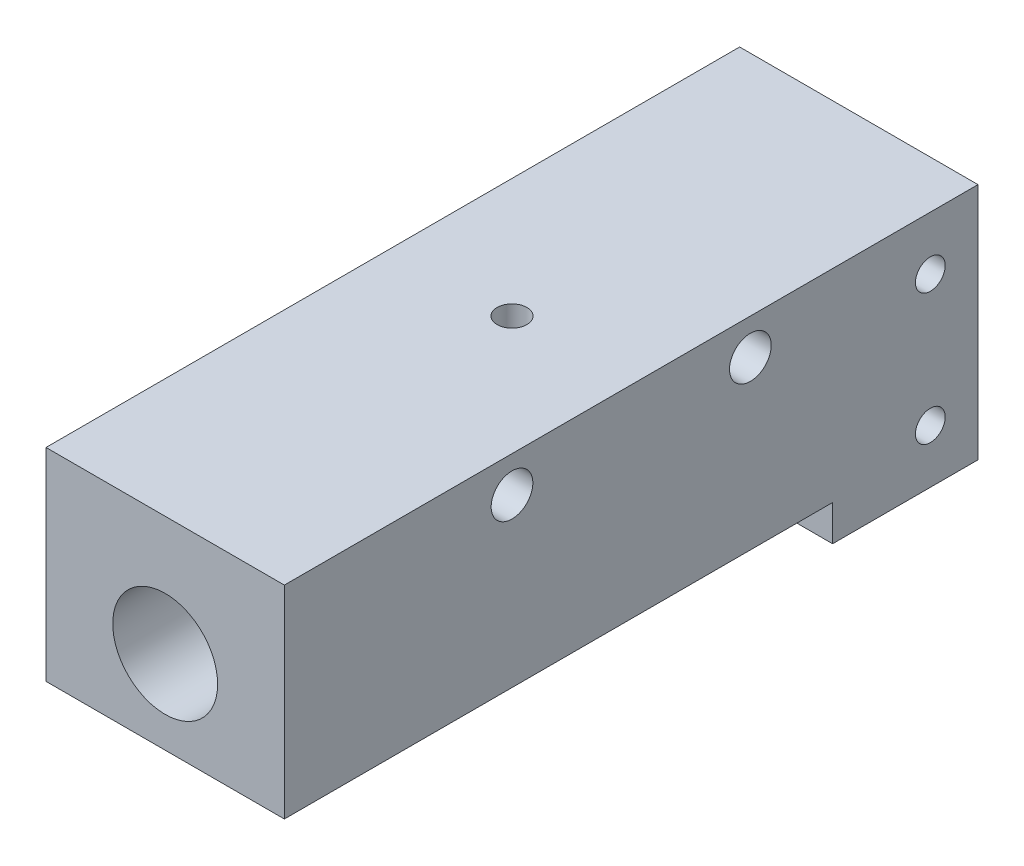
from build123d import *

# Parameters (mm, degrees)
SCHIZZO1_W                    = 20
SCHIZZO1_H                    = 20
ESTRUSIONE_ESTRUSIONE1_DEPTH  = 58.2
SCHIZZO2_R                    = 3
TAGLIO_ESTRUSIONE1_DEPTH      = 60.893572276
SCHIZZO4_R                    = 1.75
TAGLIO_ESTRUSIONE3_DEPTH      = 63.347734522
FORO_FILETTATO_G1_8_1_D       = 8.8
FORO_FILETTATO_G1_8_1_DEPTH   = 10
FORO_FILETTATO_G1_8_1_TIP     = 2.643786724
TAGLIO_ESTRUSIONE5_DEPTH      = 63.347734522
TAGLIO_ESTRUSIONE5_DEPTH_BACK = 63.347734522
FORO_FILETTATO_M3_1_D         = 2.5
FORO_FILETTATO_M3_1_DEPTH     = 5
FORO_FILETTATO_M3_1_TIP       = 0.751075774
FORO_FILETTATO_M3_2_D         = 2.5


with BuildPart() as part:
    # Schizzo1 → Estrusione-Estrusione1 (new body)
    with BuildSketch(Plane.XY):
        Rectangle(SCHIZZO1_W, SCHIZZO1_H)
    extrude(amount=-ESTRUSIONE_ESTRUSIONE1_DEPTH)

    # Schizzo2 → Taglio-Estrusione1 (cut, through all)
    with BuildSketch(Plane(origin=(0, 0, -58.2), x_dir=(-1, 0, 0), z_dir=(0, 0, -1))):
        Circle(SCHIZZO2_R)
    extrude(amount=-TAGLIO_ESTRUSIONE1_DEPTH, mode=Mode.SUBTRACT)

    # Schizzo4 → Taglio-Estrusione3 (cut, through all)
    with BuildSketch(Plane(origin=(10, 0, 0), x_dir=(0, 0, -1), z_dir=(1, 0, 0))):
        with Locations((19.1, 7)):
            Circle(SCHIZZO4_R)
        with Locations((39.1, 7)):
            Circle(SCHIZZO4_R)
    extrude(amount=-TAGLIO_ESTRUSIONE3_DEPTH, mode=Mode.SUBTRACT)

    # Foro filettato G1/8-1
    with Locations(Plane.XY):
        with Locations((0, 0)):
            Hole(FORO_FILETTATO_G1_8_1_D / 2, depth=FORO_FILETTATO_G1_8_1_DEPTH)
            with Locations((0, 0, -(FORO_FILETTATO_G1_8_1_DEPTH + FORO_FILETTATO_G1_8_1_TIP / 2))):  # 118° drill point
                Cone(0, FORO_FILETTATO_G1_8_1_D / 2, FORO_FILETTATO_G1_8_1_TIP, mode=Mode.SUBTRACT)

    # Schizzo10 → Taglio-Estrusione5 (cut, two sides: drawn at the far end of the back side and taken through both)
    with BuildSketch(Plane(origin=(10, 0, 0), x_dir=(0, 0, -1), z_dir=(1, 0, 0)).offset(-TAGLIO_ESTRUSIONE5_DEPTH_BACK)):
        Polygon((-131.2640095, -7), (0, -7), (46, -7), (46, -10), (46, -141.2640095), (-112.509379382, -350.53832089), (-289.773388882, -216.27431139), align=None)
    extrude(amount=TAGLIO_ESTRUSIONE5_DEPTH + TAGLIO_ESTRUSIONE5_DEPTH_BACK, mode=Mode.SUBTRACT)

    # Foro filettato M3-1
    with Locations(Plane(origin=(0, 10, -29.1), x_dir=(1, 0, 0), z_dir=(0, 1, 0))):
        with Locations((0, 0)):
            Hole(FORO_FILETTATO_M3_1_D / 2, depth=FORO_FILETTATO_M3_1_DEPTH)
            with Locations((0, 0, -(FORO_FILETTATO_M3_1_DEPTH + FORO_FILETTATO_M3_1_TIP / 2))):  # 118° drill point
                Cone(0, FORO_FILETTATO_M3_1_D / 2, FORO_FILETTATO_M3_1_TIP, mode=Mode.SUBTRACT)

    # Schizzo14 → Foro Ø16.0 (16)-1 (revolve, cut)
    with BuildSketch(Plane(origin=(0, 0, -58.2), x_dir=(0, 1, 0), z_dir=(1, 0, 0))):
        Polygon((0, 0), (0, 15.806884952), (8, 11), (8, 0), align=None)
    revolve(axis=Axis((0, 0, -64.55), (0, 0, 1)), mode=Mode.SUBTRACT)

    # Foro filettato M3-2 (through all)
    with Locations(Plane(origin=(10, 5.5, -54.2), x_dir=(0, 0, 1), z_dir=(1, 0, 0))):
        with Locations((0, 0), (0, 11)):
            Hole(FORO_FILETTATO_M3_2_D / 2)


solid = part.part
